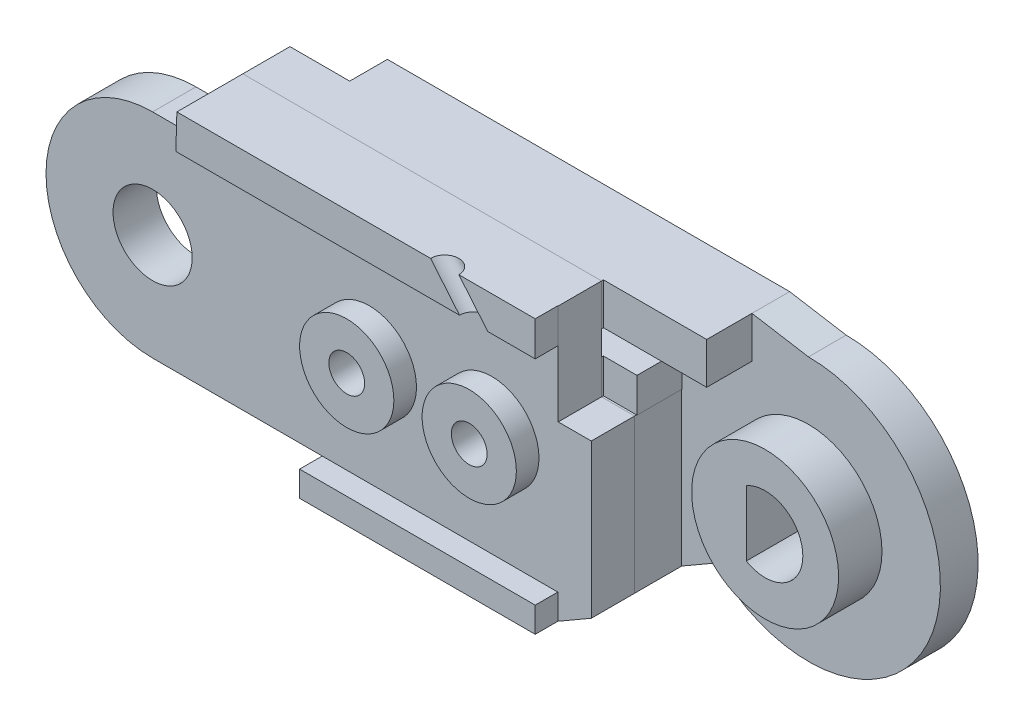
from build123d import *

# Parameters (mm, degrees)
BOSS_EXTRUDE1_DEPTH  = 2
BOSS_EXTRUDE6_DEPTH  = 2.5
CUT_EXTRUDE6_DEPTH   = 2.5
BOSS_EXTRUDE14_DEPTH = 2.3
SKETCH32_R           = 2.1
CUT_EXTRUDE7_DEPTH   = 2.3
SKETCH33_W           = 12.5
SKETCH33_H           = 1.343145751
BOSS_EXTRUDE15_DEPTH = 1.2
SKETCH35_W           = 5.479645997
SKETCH35_H           = 5.327993755
CUT_EXTRUDE8_DEPTH   = 2.4
SKETCH36_W           = 3.7
SKETCH36_H           = 1.827993755
CUT_EXTRUDE9_DEPTH   = 2.4
SKETCH37_R           = 3.9
BOSS_EXTRUDE16_DEPTH = 2.3
CUT_EXTRUDE10_DEPTH  = 38.996578793
SKETCH43_R           = 2.5
BOSS_EXTRUDE17_DEPTH = 1.2
SKETCH44_R           = 0.95
CUT_EXTRUDE11_DEPTH  = 39.590802013
SKETCH45_R           = 2
CUT_EXTRUDE12_DEPTH  = 2.5
SKETCH52_R           = 0.75
CUT_EXTRUDE13_DEPTH  = 10


with BuildPart() as part:
    # Sketch3 → Boss-Extrude1 (new body)
    with BuildSketch(Plane.XY):
        with BuildLine():
            Line((8, 0), (9, -2.5))
            Line((9, -2.5), (9, -7))
            Line((9, -7), (21.5, -7))
            Line((21.5, -7), (25.050252532, -4.949747468))
            ThreePointArc((25.050252532, -4.949747468), (36.467156728, -2.678784027), (30, 7))
            Line((30, 7), (27, 7.5))
            Line((27, 7.5), (5.656854249, 7.5))
            Line((5.656854249, 7.5), (5.656854249, 5.656854249))
            ThreePointArc((5.656854249, 5.656854249), (7.39103626, 3.061467459), (8, 0))
        make_face()
    extrude(amount=BOSS_EXTRUDE1_DEPTH)

    # Sketch22 → Boss-Extrude6 (add)
    with BuildSketch(Plane.XY.offset(2)):
        with BuildLine():
            Line((5.656854249, 5.656854249), (2.486790148, 5.656854249))
            Line((2.486790148, 5.656854249), (2.486790148, 7.5))
            Line((2.486790148, 7.5), (5.656854249, 7.5))
            Line((5.656854249, 7.5), (21.5, 7.5))
            Line((21.5, 7.5), (27, 7.5))
            Line((27, 7.5), (27, 2.172006245))
            Line((27, 2.172006245), (23.275126266, 2.172006245))
            Line((23.275126266, 2.172006245), (23.275126266, -5.974873734))
            Line((23.275126266, -5.974873734), (21.5, -7))
            Line((21.5, -7), (9, -7))
            Line((9, -7), (9, -2.5))
            Line((9, -2.5), (8, 0))
            ThreePointArc((8, 0), (7.39103626, 3.061467459), (5.656854249, 5.656854249))
        make_face()
    extrude(amount=BOSS_EXTRUDE6_DEPTH)

    # Sketch26 → Cut-Extrude6 (cut)
    with BuildSketch(Plane.XY.offset(2)):
        Polygon((18.098080448, 5.3), (2.530052458, 5.3), (2.530052458, 4), (18.098080448, 4), (27, 4), (27, 5.3), align=None)
    extrude(amount=CUT_EXTRUDE6_DEPTH, mode=Mode.SUBTRACT)


with BuildPart() as body_2:
    # Sketch31 → Boss-Extrude14 (new body)
    with BuildSketch(Plane.XY.offset(4.5)):
        with BuildLine():
            Line((2.432688066, 5.656854249), (0, 5.656854249))
            ThreePointArc((0, 5.656854249), (-5.656854249, 0), (0, -5.656854249))
            Line((0, -5.656854249), (9, -5.656854249))
            Line((9, -5.656854249), (9, -7))
            Line((9, -7), (21.5, -7))
            Line((21.5, -7), (23.275126266, -5.974873734))
            Line((23.275126266, -5.974873734), (23.275126266, 2.172006245))
            Line((23.275126266, 2.172006245), (27, 2.172006245))
            Line((27, 2.172006245), (27, 7.5))
            Line((27, 7.5), (2.486790148, 7.5))
            Line((2.486790148, 7.5), (2.432688066, 5.656854249))
        make_face()
    extrude(amount=BOSS_EXTRUDE14_DEPTH)

    # Sketch32 → Cut-Extrude7 (cut)
    with BuildSketch(Plane.XY.offset(6.8)):
        Circle(SKETCH32_R)
    extrude(amount=-CUT_EXTRUDE7_DEPTH, mode=Mode.SUBTRACT)

    # Sketch33 → Boss-Extrude15 (add)
    with BuildSketch(Plane.XY.offset(6.8)):
        with Locations((15.25, -6.328427125)):
            Rectangle(SKETCH33_W, SKETCH33_H)
        Polygon((2.486790148, 7.5), (21.5, 7.5), (21.5, 5.656854249), (2.432688066, 5.656854249), align=None)
    extrude(amount=BOSS_EXTRUDE15_DEPTH)


with BuildPart() as cut_extrude8_tool:
    # Sketch35 → Cut-Extrude8 (new body)
    with BuildSketch(Plane.XY.offset(6.8)):
        with Locations((24.260177002, 4.836003123)):
            Rectangle(SKETCH35_W, SKETCH35_H)
    extrude(amount=-CUT_EXTRUDE8_DEPTH)


with BuildPart() as part_1:
    add(part.part)

    # Cut-Extrude8: cut by cut_extrude8_tool
    add(cut_extrude8_tool.part, mode=Mode.SUBTRACT)

    # Sketch36 → Cut-Extrude9 (cut)
    with BuildSketch(Plane.XY.offset(4.4)):
        with Locations((25.15, 3.086003123)):
            Rectangle(SKETCH36_W, SKETCH36_H)
    extrude(amount=-CUT_EXTRUDE9_DEPTH, mode=Mode.SUBTRACT)

    # Sketch37 → Boss-Extrude16 (add)
    with BuildSketch(Plane.XY.offset(2)):
        with Locations((30, 0)):
            Circle(SKETCH37_R)
    extrude(amount=BOSS_EXTRUDE16_DEPTH)

    # Sketch39 → Cut-Extrude10 (cut, through all)
    with BuildSketch(Plane.XY.offset(4.3)):
        with BuildLine():
            Line((29, 1.732050808), (29, -1.732050808))
            ThreePointArc((29, -1.732050808), (32, 0), (29, 1.732050808))
        make_face()
    extrude(amount=-CUT_EXTRUDE10_DEPTH, mode=Mode.SUBTRACT)


with BuildPart() as body_2_1:
    add(body_2.part)

    # Cut-Extrude8: cut by cut_extrude8_tool
    add(cut_extrude8_tool.part, mode=Mode.SUBTRACT)

    # Sketch43 → Boss-Extrude17 (add)
    with BuildSketch(Plane.XY.offset(6.8)):
        with Locations((11.5, 0)):
            Circle(SKETCH43_R)
        with Locations((18, 0)):
            Circle(SKETCH43_R)
    extrude(amount=BOSS_EXTRUDE17_DEPTH)


with BuildPart() as cut_extrude11_tool:
    # Sketch44 → Cut-Extrude11 (new, through all)
    with BuildSketch(Plane.XY.offset(8)):
        with Locations((11.5, 0)):
            Circle(SKETCH44_R)
        with Locations((18, 0)):
            Circle(SKETCH44_R)
    extrude(amount=-CUT_EXTRUDE11_DEPTH)


with BuildPart() as part_2:
    add(part_1.part)

    # Cut-Extrude11: cut by cut_extrude11_tool
    add(cut_extrude11_tool.part, mode=Mode.SUBTRACT)

    # Sketch45 → Cut-Extrude12 (cut)
    with BuildSketch(Plane(origin=(0, 0, 0), x_dir=(-1, 0, 0), z_dir=(0, 0, -1))):
        with Locations((-11.5, 0)):
            Circle(SKETCH45_R)
        with Locations((-18, 0)):
            Circle(SKETCH45_R)
    extrude(amount=-CUT_EXTRUDE12_DEPTH, mode=Mode.SUBTRACT)


with BuildPart() as body_2_2:
    add(body_2_1.part)

    # Cut-Extrude11: cut by cut_extrude11_tool
    add(cut_extrude11_tool.part, mode=Mode.SUBTRACT)

    # Sketch52 → Cut-Extrude13 (cut, along a direction that is not the sketch's normal)
    with BuildSketch(Plane.XZ.offset(-5.656854249)):
        with Locations((18.235476819, 8)):
            Circle(SKETCH52_R)
    extrude(amount=-CUT_EXTRUDE13_DEPTH, dir=(0.6404101962115248, -0.7680330595673056, 0), mode=Mode.SUBTRACT)


solid = Compound([part_2.part, body_2_2.part])
